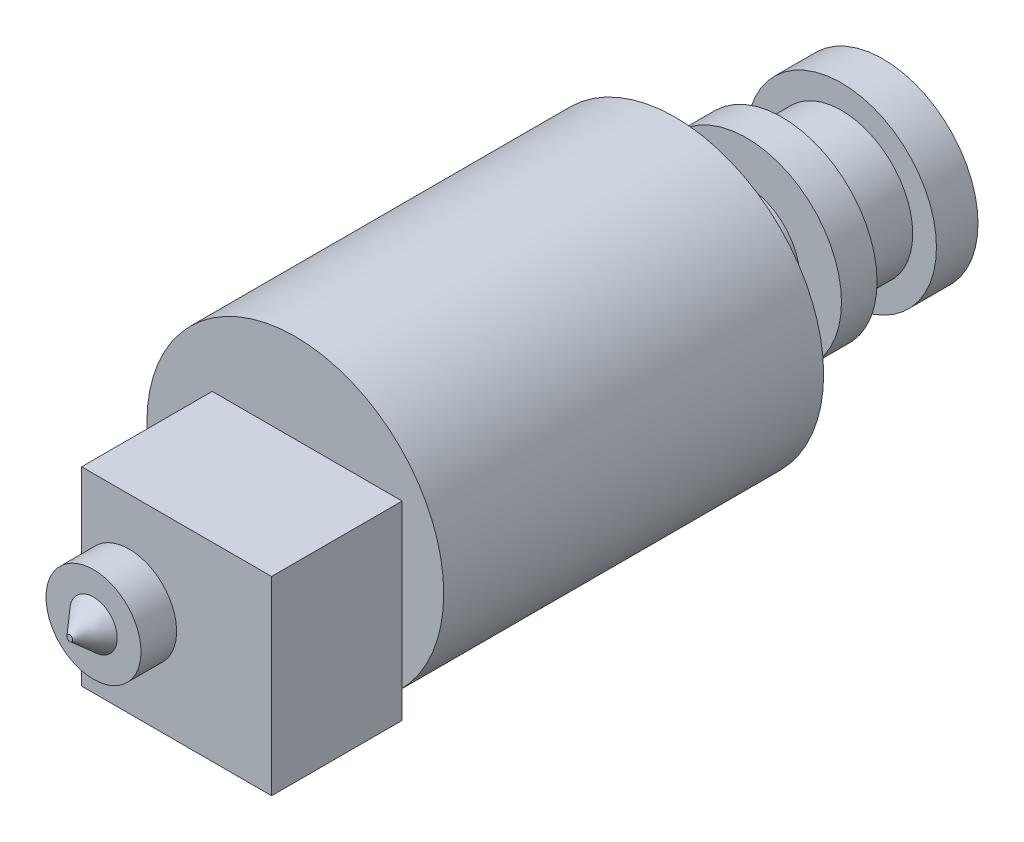
from build123d import *

# Parameters (mm, degrees)
SKETCH1_R           = 8
BOSS_EXTRUDE1_DEPTH = 3.5
SKETCH2_R           = 6
BOSS_EXTRUDE2_DEPTH = 5
SKETCH3_R           = 8
BOSS_EXTRUDE3_DEPTH = 3
SKETCH4_R           = 4.5
BOSS_EXTRUDE4_DEPTH = 6
SKETCH5_R           = 12.5
BOSS_EXTRUDE5_DEPTH = 32
SKETCH6_R           = 3
BOSS_EXTRUDE6_DEPTH = 3
SKETCH7_W           = 16
SKETCH7_H           = 16
BOSS_EXTRUDE7_DEPTH = 11
SKETCH8_R           = 4
BOSS_EXTRUDE8_DEPTH = 3
SKETCH10_R          = 1.5
CUT_EXTRUDE1_DEPTH  = 2


with BuildPart() as part:
    # Sketch1 → Boss-Extrude1 (new body)
    with BuildSketch(Plane.XY):
        Circle(SKETCH1_R)
    extrude(amount=BOSS_EXTRUDE1_DEPTH)

    # Sketch2 → Boss-Extrude2 (add)
    with BuildSketch(Plane.XY.offset(3.5)):
        Circle(SKETCH2_R)
    extrude(amount=BOSS_EXTRUDE2_DEPTH)

    # Sketch3 → Boss-Extrude3 (add)
    with BuildSketch(Plane.XY.offset(8.5)):
        Circle(SKETCH3_R)
    extrude(amount=BOSS_EXTRUDE3_DEPTH)

    # Sketch4 → Boss-Extrude4 (add)
    with BuildSketch(Plane.XY.offset(11.5)):
        Circle(SKETCH4_R)
    extrude(amount=BOSS_EXTRUDE4_DEPTH)

    # Sketch5 → Boss-Extrude5 (add)
    with BuildSketch(Plane.XY.offset(17.5)):
        Circle(SKETCH5_R)
    extrude(amount=BOSS_EXTRUDE5_DEPTH)

    # Sketch6 → Boss-Extrude6 (add)
    with BuildSketch(Plane.XY.offset(49.5)):
        Circle(SKETCH6_R)
    extrude(amount=BOSS_EXTRUDE6_DEPTH)

    # Sketch7 → Boss-Extrude7 (add)
    with BuildSketch(Plane.XY.offset(52.5)):
        with Locations((4, 0)):
            Rectangle(SKETCH7_W, SKETCH7_H)
    extrude(amount=BOSS_EXTRUDE7_DEPTH)

    # Sketch8 → Boss-Extrude8 (add)
    with BuildSketch(Plane.XY.offset(63.5)):
        with Locations(Location((0, 0, 0), (0, 0, 180))):
            Circle(SKETCH8_R)
    extrude(amount=BOSS_EXTRUDE8_DEPTH)

    # Sketch10 → Cut-Extrude1 (cut)
    with BuildSketch(Plane(origin=(0, 0, 0), x_dir=(-1, 0, 0), z_dir=(0, 0, -1))):
        Circle(SKETCH10_R)
    extrude(amount=-CUT_EXTRUDE1_DEPTH, mode=Mode.SUBTRACT)

    # Loft1: read off the stored shape, not the designer's step
    # Loft1: loft between two sections, ruled curve by curve
    loft1_from = [
        Edge.make_bspline([(-0.247162936, 0.037556397, 68.5), (-0.172050142, 0.53188227, 68.5), (0.322275731, 0.456769475, 68.5), (0.247162936, -0.037556397, 68.5), (0.172050142, -0.53188227, 68.5), (-0.322275731, -0.456769475, 68.5), (-0.247162936, 0.037556397, 68.5)], [0, 0, 0, 0, 0.5, 0.5, 0.5, 1, 1, 1, 1], 3, [1, 0.333333333, 0.333333333, 1, 0.333333333, 0.333333333, 1]),
    ]
    loft1_to = [
        Edge.make_bspline([(-1.919178945, -0.562807407, 66.5), (-3.044793759, 3.275550482, 66.5), (0.79356413, 4.401165297, 66.5), (1.919178945, 0.562807407, 66.5), (3.044793759, -3.275550482, 66.5), (-0.79356413, -4.401165297, 66.5), (-1.919178945, -0.562807407, 66.5)], [0, 0, 0, 0, 0.5, 0.5, 0.5, 1, 1, 1, 1], 3, [1, 0.333333333, 0.333333333, 1, 0.333333333, 0.333333333, 1]),
    ]
    loft1 = Solid(Shell([*[Face.make_surface_from_curves(loft1_from[k], loft1_to[k]) for k in range(1)], Face(Wire(loft1_from)), Face(Wire(loft1_to))]))
    add(loft1)


solid = part.part
